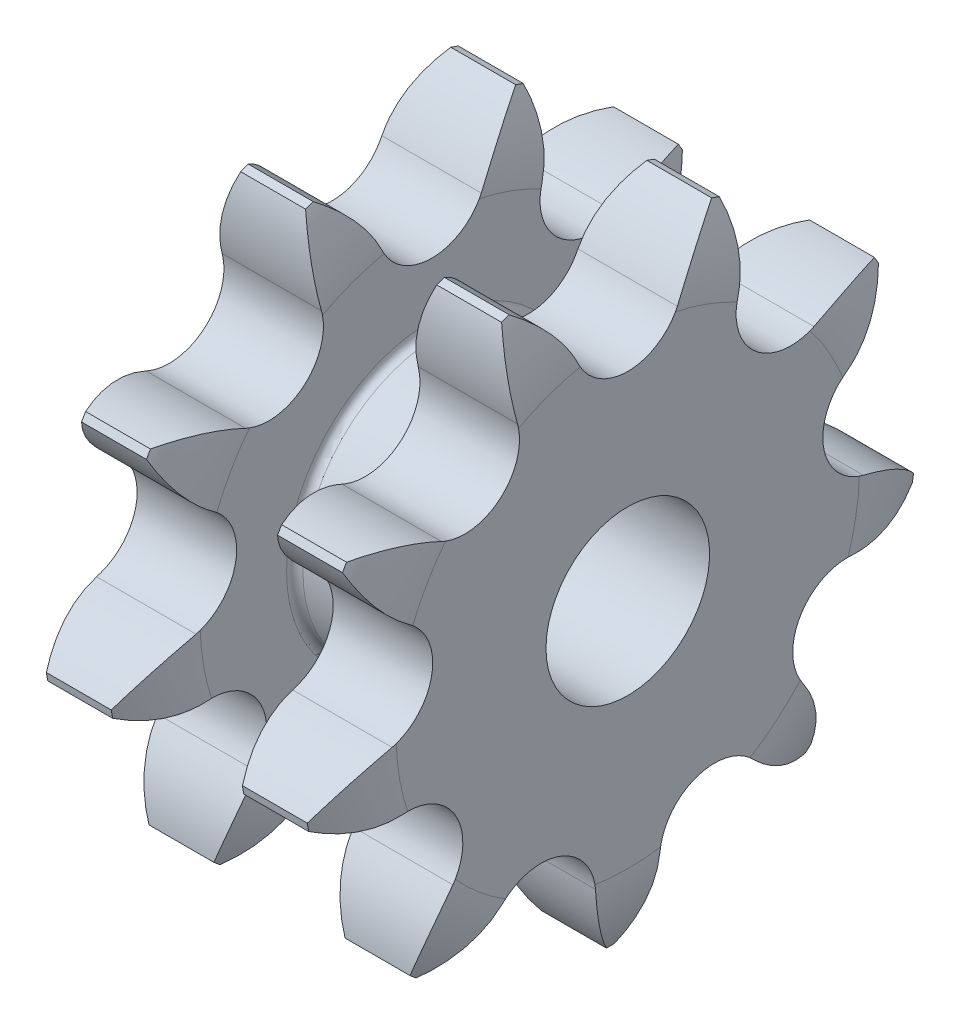
from build123d import *

# Parameters (mm, degrees)
TOOTHCUT_DEPTH  = 39.537037497
TEETHCUTS_COUNT = 9
TEETHCUTS_ANGLE = 320
BORSKE_R        = 6
BORE_DEPTH      = 23.8805


with BuildPart() as part:
    # BasProSke → Base-Revolve (revolve)
    with BuildSketch(Plane(origin=(0, 0, 0), x_dir=(1, 0, 0), z_dir=(0, 1, 0))):
        with BuildLine():
            Line((0, 0), (0, 16.992856303))
            ThreePointArc((0, 16.992856303), (0.321571182, 19.832662635), (1.27, 22.528657961))
            Line((1.27, 22.528657961), (20.41, 22.528657961))
            ThreePointArc((20.41, 22.528657961), (21.358428818, 19.832662635), (21.68, 16.992856303))
            Line((21.68, 16.992856303), (21.68, 0))
            Line((21.68, 0), (0, 0))
        make_face()
    revolve(axis=Axis((-10, 0, 0), (1, 0, 0)))

    # GrvSke → Groove (revolve, cut)
    with BuildSketch(Plane(origin=(0, 0, 0), x_dir=(1, 0, 0), z_dir=(0, 1, 0))):
        with BuildLine():
            Line((7.3, 16.992856303), (7.3, 10.646481635))
            ThreePointArc((7.3, 10.646481635), (7.475735931, 10.222217566), (7.9, 10.046481635))
            Line((7.9, 10.046481635), (13.78, 10.046481635))
            ThreePointArc((13.78, 10.046481635), (14.204264069, 10.222217566), (14.38, 10.646481635))
            Line((14.38, 10.646481635), (14.38, 16.992856303))
            ThreePointArc((14.38, 16.992856303), (14.701571182, 19.832662635), (15.65, 22.528657961))
            Line((15.65, 22.528657961), (6.03, 22.528657961))
            ThreePointArc((6.03, 22.528657961), (6.978428818, 19.832662635), (7.3, 16.992856303))
        make_face()
    revolve(axis=Axis((0, 0, 0), (1, 0, 0)), mode=Mode.SUBTRACT)

    # TooCutSke → ToothCut (cut, through all)
    with BuildSketch(Plane(origin=(0, 0, 0), x_dir=(0, 0, -1), z_dir=(1, 0, 0))):
        with BuildLine():
            ThreePointArc((3.638599188, 16.909201295), (5.440645741, 19.594585844), (7.97480479, 21.603739863))
            ThreePointArc((7.97480479, 21.603739863), (0, 23.028657961), (-7.97480479, 21.603739863))
            ThreePointArc((-7.97480479, 21.603739863), (-5.440645741, 19.594585844), (-3.638599188, 16.909201295))
            ThreePointArc((-3.638599188, 16.909201295), (0, 14.591157961), (3.638599188, 16.909201295))
        make_face()
    toothcut = extrude(amount=TOOTHCUT_DEPTH, mode=Mode.SUBTRACT)

    # TeethCuts: ToothCut ×9 about axis
    teethcuts_axis = Axis((-10, 0, 0), (1, 0, 0))
    for i in range(1, TEETHCUTS_COUNT):
        add(toothcut.rotate(teethcuts_axis, i * TEETHCUTS_ANGLE / (TEETHCUTS_COUNT - 1)), mode=Mode.SUBTRACT)

    # BorSke → Bore (cut, symmetric)
    with BuildSketch(Plane(origin=(0, 0, 0), x_dir=(0, 0, -1), z_dir=(1, 0, 0))):
        Circle(BORSKE_R)
    extrude(amount=BORE_DEPTH, both=True, mode=Mode.SUBTRACT)


solid = part.part
